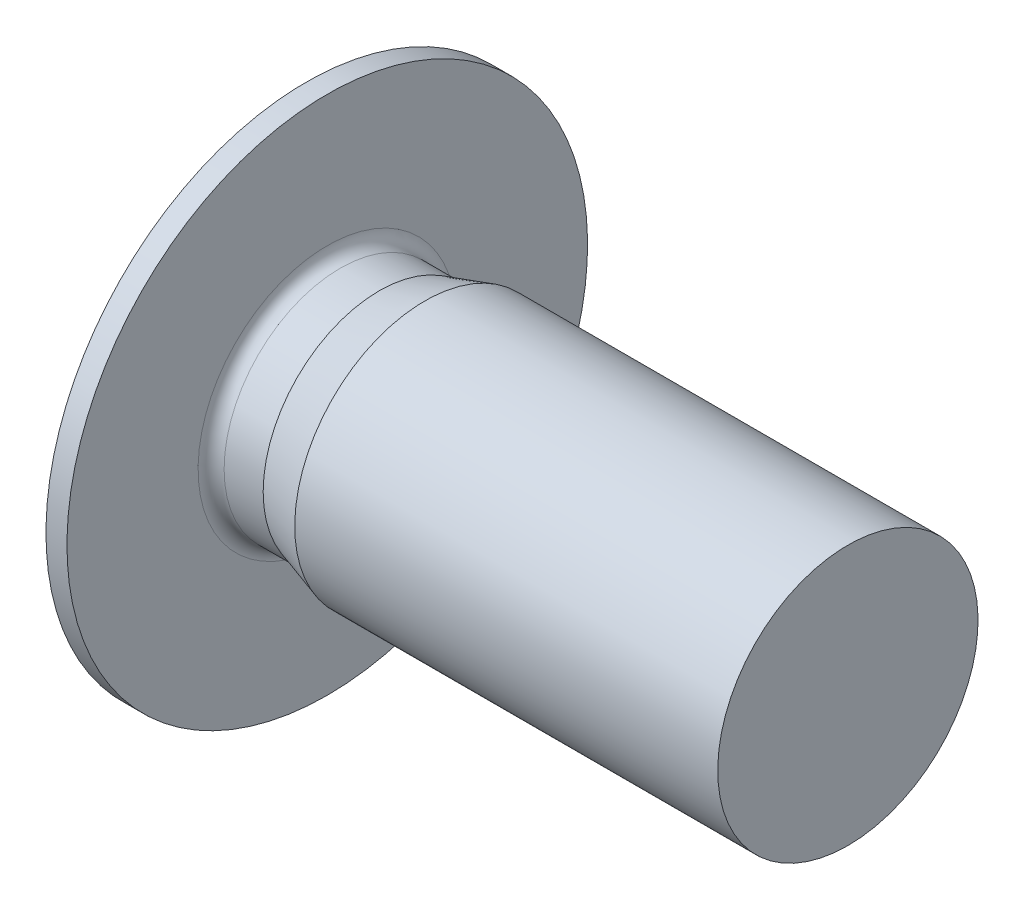
from build123d import *

# Parameters (mm, degrees)
FILLET1_R          = 0.2
CUT_EXTRUDE1_DEPTH = 2.5


with BuildPart() as part:
    # Sketch1 → Revolve1 (revolve)
    with BuildSketch(Plane.XY):
        Polygon((-0.9, 0), (-0.9, 3), (-0.322649731, 4), (0, 4), (0, 1.785), (0.8, 1.785), (1.5, 2), (8, 2), (8, 0), align=None)
    revolve(axis=Axis((-0.9, 0, 0), (1, 0, 0)))

    # Fillet1
    fillet1_edges = [part.edges().sort_by_distance(p)[0] for p in [
        (0, -1.785, 0),
    ]]
    fillet(fillet1_edges, radius=FILLET1_R)

    # Sketch2 → Cut-Extrude1 (cut)
    with BuildSketch(Plane.ZY.offset(0.9)):
        Polygon((0, 1.154700538), (-1, 0.577350269), (-1, -0.577350269), (0, -1.154700538), (1, -0.577350269), (1, 0.577350269), align=None)
    extrude(amount=-CUT_EXTRUDE1_DEPTH, mode=Mode.SUBTRACT)

    # Sketch3 → Cut-Revolve1 (revolve, cut)
    with BuildSketch(Plane.XY):
        Polygon((1.6, 0), (1.6, 1), (2.200860619, 0), align=None)
    revolve(axis=Axis((1.6, 0, 0), (1, 0, 0)), mode=Mode.SUBTRACT)


solid = part.part
